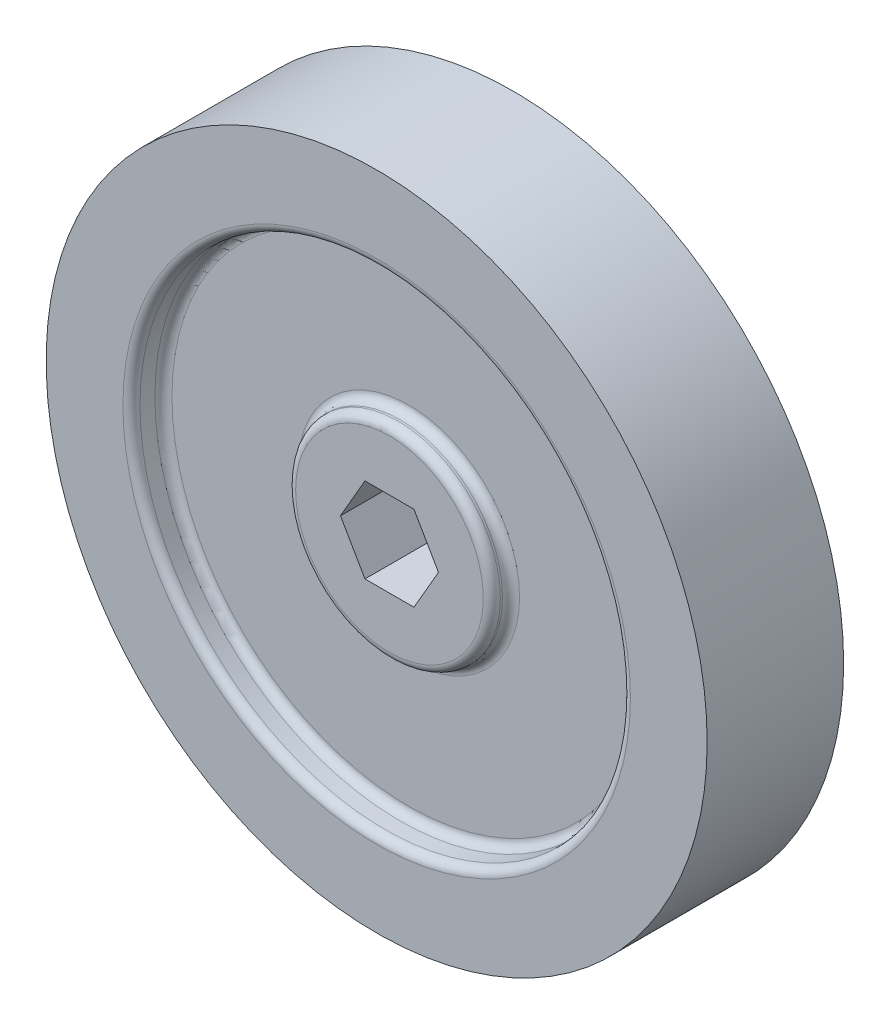
from build123d import *

# Parameters (mm, degrees)
BOSS_EXTRUDE1_DEPTH      = 10.16
BOSS_EXTRUDE1_DEPTH_BACK = 10.16
SKETCH1_R                = 49.2125
CUT_EXTRUDE1_DEPTH       = 73.502708311
FILLET1_R                = 1.27
FILLET2_R                = 1.27


with BuildPart() as part:
    # Sketch1 → Boss-Extrude1 (new, two sides: drawn at the far end of the back side and taken through both)
    with BuildSketch(Plane.XY.offset(-BOSS_EXTRUDE1_DEPTH_BACK)):
        Circle(SKETCH1_R)
    extrude(amount=BOSS_EXTRUDE1_DEPTH + BOSS_EXTRUDE1_DEPTH_BACK)

    # Sketch2 → Cut-Extrude1 (cut, through all)
    with BuildSketch(Plane.XY.offset(10.16)):
        Polygon((3.648853701, 6.32), (-3.648853701, 6.32), (-7.297707403, 0), (-3.648853701, -6.32), (3.648853701, -6.32), (7.297707403, 0), align=None)
    extrude(amount=-CUT_EXTRUDE1_DEPTH, mode=Mode.SUBTRACT)

    # Sketch3 → Cut-Revolve1 (revolve, cut)
    with BuildSketch(Plane(origin=(0, 0, 0), x_dir=(0, 0, -1), z_dir=(1, 0, 0))):
        Polygon((8.255, 15.24), (5.3975, 15.24), (5.3975, 36.5125), (10.16, 36.5125), (10.16, 0), (8.255, 0), align=None)
    cut_revolve1 = revolve(axis=Axis((0, 0, -22.753035396), (0, 0, 1)), mode=Mode.SUBTRACT)

    # Fillet1
    fillet1_edges = [part.edges().sort_by_distance(p)[0] for p in [
        (0, -15.24, -5.3975),
        (0, -36.5125, -10.16),
        (0, -15.24, -8.255),
    ]]
    fillet(fillet1_edges, radius=FILLET1_R)

    # Mirror1: Cut-Revolve1 across plane
    add(cut_revolve1.mirror(Plane.XY), mode=Mode.SUBTRACT)

    # Fillet2
    fillet2_edges = [part.edges().sort_by_distance(p)[0] for p in [
        (0, -36.5125, 10.16),
        (0, -36.5125, 5.3975),
        (0, -15.24, 5.3975),
        (0, -15.24, 8.255),
    ]]
    fillet(fillet2_edges, radius=FILLET2_R)


solid = part.part
